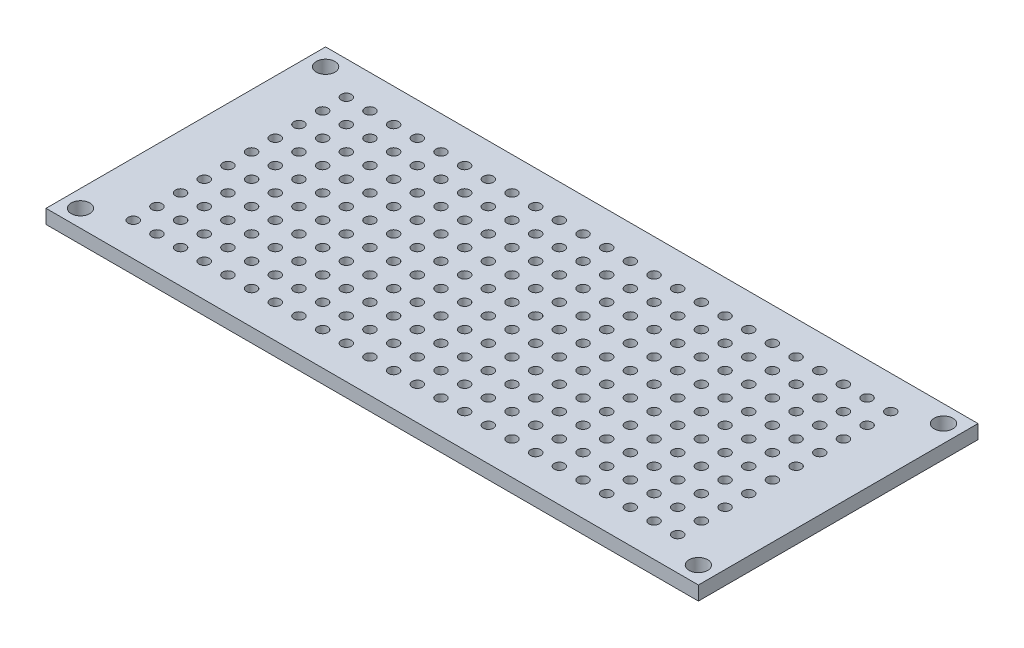
from build123d import *

# Parameters (mm, degrees)
SKETCH1_W           = 70
SKETCH1_H           = 30
BOSS_EXTRUDE1_DEPTH = 1.5
SKETCH2_R           = 0.55
CUT_EXTRUDE1_DEPTH  = 39.108398025
SKETCH3_R           = 1
CUT_EXTRUDE2_DEPTH  = 39.108398025


with BuildPart() as part:
    # Sketch1 → Boss-Extrude1 (new body)
    with BuildSketch(Plane(origin=(0, 0, 0), x_dir=(1, 0, 0), z_dir=(0, 1, 0))):
        Rectangle(SKETCH1_W, SKETCH1_H)
    extrude(amount=BOSS_EXTRUDE1_DEPTH)

    # Sketch2 → Cut-Extrude1 (cut, through all)
    with BuildSketch(Plane(origin=(0, 1.5, 0), x_dir=(1, 0, 0), z_dir=(0, 1, 0))):
        with Locations((1.27, 1.27)):
            Circle(SKETCH2_R)
        with Locations((3.81, 1.27)):
            Circle(SKETCH2_R)
        with Locations((6.35, 1.27)):
            Circle(SKETCH2_R)
        with Locations((8.89, 1.27)):
            Circle(SKETCH2_R)
        with Locations((11.43, 1.27)):
            Circle(SKETCH2_R)
        with Locations((13.97, 1.27)):
            Circle(SKETCH2_R)
        with Locations((16.51, 1.27)):
            Circle(SKETCH2_R)
        with Locations((19.05, 1.27)):
            Circle(SKETCH2_R)
        with Locations((21.59, 1.27)):
            Circle(SKETCH2_R)
        with Locations((24.13, 1.27)):
            Circle(SKETCH2_R)
        with Locations((26.67, 1.27)):
            Circle(SKETCH2_R)
        with Locations((29.21, 1.27)):
            Circle(SKETCH2_R)
        with Locations((3.81, 3.81)):
            Circle(SKETCH2_R)
        with Locations((6.35, 3.81)):
            Circle(SKETCH2_R)
        with Locations((8.89, 3.81)):
            Circle(SKETCH2_R)
        with Locations((11.43, 3.81)):
            Circle(SKETCH2_R)
        with Locations((13.97, 3.81)):
            Circle(SKETCH2_R)
        with Locations((16.51, 3.81)):
            Circle(SKETCH2_R)
        with Locations((19.05, 3.81)):
            Circle(SKETCH2_R)
        with Locations((21.59, 3.81)):
            Circle(SKETCH2_R)
        with Locations((24.13, 3.81)):
            Circle(SKETCH2_R)
        with Locations((26.67, 3.81)):
            Circle(SKETCH2_R)
        with Locations((29.21, 3.81)):
            Circle(SKETCH2_R)
        with Locations((3.81, 6.35)):
            Circle(SKETCH2_R)
        with Locations((6.35, 6.35)):
            Circle(SKETCH2_R)
        with Locations((8.89, 6.35)):
            Circle(SKETCH2_R)
        with Locations((11.43, 6.35)):
            Circle(SKETCH2_R)
        with Locations((13.97, 6.35)):
            Circle(SKETCH2_R)
        with Locations((16.51, 6.35)):
            Circle(SKETCH2_R)
        with Locations((19.05, 6.35)):
            Circle(SKETCH2_R)
        with Locations((21.59, 6.35)):
            Circle(SKETCH2_R)
        with Locations((24.13, 6.35)):
            Circle(SKETCH2_R)
        with Locations((26.67, 6.35)):
            Circle(SKETCH2_R)
        with Locations((29.21, 6.35)):
            Circle(SKETCH2_R)
        with Locations((3.81, 8.89)):
            Circle(SKETCH2_R)
        with Locations((6.35, 8.89)):
            Circle(SKETCH2_R)
        with Locations((8.89, 8.89)):
            Circle(SKETCH2_R)
        with Locations((11.43, 8.89)):
            Circle(SKETCH2_R)
        with Locations((13.97, 8.89)):
            Circle(SKETCH2_R)
        with Locations((16.51, 8.89)):
            Circle(SKETCH2_R)
        with Locations((19.05, 8.89)):
            Circle(SKETCH2_R)
        with Locations((21.59, 8.89)):
            Circle(SKETCH2_R)
        with Locations((24.13, 8.89)):
            Circle(SKETCH2_R)
        with Locations((26.67, 8.89)):
            Circle(SKETCH2_R)
        with Locations((29.21, 8.89)):
            Circle(SKETCH2_R)
        with Locations((3.81, 11.43)):
            Circle(SKETCH2_R)
        with Locations((6.35, 11.43)):
            Circle(SKETCH2_R)
        with Locations((8.89, 11.43)):
            Circle(SKETCH2_R)
        with Locations((11.43, 11.43)):
            Circle(SKETCH2_R)
        with Locations((13.97, 11.43)):
            Circle(SKETCH2_R)
        with Locations((16.51, 11.43)):
            Circle(SKETCH2_R)
        with Locations((19.05, 11.43)):
            Circle(SKETCH2_R)
        with Locations((21.59, 11.43)):
            Circle(SKETCH2_R)
        with Locations((24.13, 11.43)):
            Circle(SKETCH2_R)
        with Locations((26.67, 11.43)):
            Circle(SKETCH2_R)
        with Locations((29.21, 11.43)):
            Circle(SKETCH2_R)
        with Locations((1.27, 3.81)):
            Circle(SKETCH2_R)
        with Locations((1.27, 6.35)):
            Circle(SKETCH2_R)
        with Locations((1.27, 8.89)):
            Circle(SKETCH2_R)
        with Locations((1.27, 11.43)):
            Circle(SKETCH2_R)
        with Locations((1.27, -11.43)):
            Circle(SKETCH2_R)
        with Locations((1.27, -8.89)):
            Circle(SKETCH2_R)
        with Locations((1.27, -6.35)):
            Circle(SKETCH2_R)
        with Locations((1.27, -3.81)):
            Circle(SKETCH2_R)
        with Locations((29.21, -11.43)):
            Circle(SKETCH2_R)
        with Locations((26.67, -11.43)):
            Circle(SKETCH2_R)
        with Locations((24.13, -11.43)):
            Circle(SKETCH2_R)
        with Locations((21.59, -11.43)):
            Circle(SKETCH2_R)
        with Locations((19.05, -11.43)):
            Circle(SKETCH2_R)
        with Locations((16.51, -11.43)):
            Circle(SKETCH2_R)
        with Locations((13.97, -11.43)):
            Circle(SKETCH2_R)
        with Locations((11.43, -11.43)):
            Circle(SKETCH2_R)
        with Locations((8.89, -11.43)):
            Circle(SKETCH2_R)
        with Locations((6.35, -11.43)):
            Circle(SKETCH2_R)
        with Locations((3.81, -11.43)):
            Circle(SKETCH2_R)
        with Locations((29.21, -8.89)):
            Circle(SKETCH2_R)
        with Locations((26.67, -8.89)):
            Circle(SKETCH2_R)
        with Locations((24.13, -8.89)):
            Circle(SKETCH2_R)
        with Locations((21.59, -8.89)):
            Circle(SKETCH2_R)
        with Locations((19.05, -8.89)):
            Circle(SKETCH2_R)
        with Locations((16.51, -8.89)):
            Circle(SKETCH2_R)
        with Locations((13.97, -8.89)):
            Circle(SKETCH2_R)
        with Locations((11.43, -8.89)):
            Circle(SKETCH2_R)
        with Locations((8.89, -8.89)):
            Circle(SKETCH2_R)
        with Locations((6.35, -8.89)):
            Circle(SKETCH2_R)
        with Locations((3.81, -8.89)):
            Circle(SKETCH2_R)
        with Locations((29.21, -6.35)):
            Circle(SKETCH2_R)
        with Locations((26.67, -6.35)):
            Circle(SKETCH2_R)
        with Locations((24.13, -6.35)):
            Circle(SKETCH2_R)
        with Locations((21.59, -6.35)):
            Circle(SKETCH2_R)
        with Locations((19.05, -6.35)):
            Circle(SKETCH2_R)
        with Locations((16.51, -6.35)):
            Circle(SKETCH2_R)
        with Locations((13.97, -6.35)):
            Circle(SKETCH2_R)
        with Locations((11.43, -6.35)):
            Circle(SKETCH2_R)
        with Locations((8.89, -6.35)):
            Circle(SKETCH2_R)
        with Locations((6.35, -6.35)):
            Circle(SKETCH2_R)
        with Locations((3.81, -6.35)):
            Circle(SKETCH2_R)
        with Locations((29.21, -3.81)):
            Circle(SKETCH2_R)
        with Locations((26.67, -3.81)):
            Circle(SKETCH2_R)
        with Locations((24.13, -3.81)):
            Circle(SKETCH2_R)
        with Locations((21.59, -3.81)):
            Circle(SKETCH2_R)
        with Locations((19.05, -3.81)):
            Circle(SKETCH2_R)
        with Locations((16.51, -3.81)):
            Circle(SKETCH2_R)
        with Locations((13.97, -3.81)):
            Circle(SKETCH2_R)
        with Locations((11.43, -3.81)):
            Circle(SKETCH2_R)
        with Locations((8.89, -3.81)):
            Circle(SKETCH2_R)
        with Locations((6.35, -3.81)):
            Circle(SKETCH2_R)
        with Locations((3.81, -3.81)):
            Circle(SKETCH2_R)
        with Locations((29.21, -1.27)):
            Circle(SKETCH2_R)
        with Locations((26.67, -1.27)):
            Circle(SKETCH2_R)
        with Locations((24.13, -1.27)):
            Circle(SKETCH2_R)
        with Locations((21.59, -1.27)):
            Circle(SKETCH2_R)
        with Locations((19.05, -1.27)):
            Circle(SKETCH2_R)
        with Locations((16.51, -1.27)):
            Circle(SKETCH2_R)
        with Locations((13.97, -1.27)):
            Circle(SKETCH2_R)
        with Locations((11.43, -1.27)):
            Circle(SKETCH2_R)
        with Locations((8.89, -1.27)):
            Circle(SKETCH2_R)
        with Locations((6.35, -1.27)):
            Circle(SKETCH2_R)
        with Locations((3.81, -1.27)):
            Circle(SKETCH2_R)
        with Locations((1.27, -1.27)):
            Circle(SKETCH2_R)
        with Locations((-1.27, -1.27)):
            Circle(SKETCH2_R)
        with Locations((-3.81, -1.27)):
            Circle(SKETCH2_R)
        with Locations((-6.35, -1.27)):
            Circle(SKETCH2_R)
        with Locations((-8.89, -1.27)):
            Circle(SKETCH2_R)
        with Locations((-11.43, -1.27)):
            Circle(SKETCH2_R)
        with Locations((-13.97, -1.27)):
            Circle(SKETCH2_R)
        with Locations((-16.51, -1.27)):
            Circle(SKETCH2_R)
        with Locations((-19.05, -1.27)):
            Circle(SKETCH2_R)
        with Locations((-21.59, -1.27)):
            Circle(SKETCH2_R)
        with Locations((-24.13, -1.27)):
            Circle(SKETCH2_R)
        with Locations((-26.67, -1.27)):
            Circle(SKETCH2_R)
        with Locations((-29.21, -1.27)):
            Circle(SKETCH2_R)
        with Locations((-3.81, -3.81)):
            Circle(SKETCH2_R)
        with Locations((-6.35, -3.81)):
            Circle(SKETCH2_R)
        with Locations((-8.89, -3.81)):
            Circle(SKETCH2_R)
        with Locations((-11.43, -3.81)):
            Circle(SKETCH2_R)
        with Locations((-13.97, -3.81)):
            Circle(SKETCH2_R)
        with Locations((-16.51, -3.81)):
            Circle(SKETCH2_R)
        with Locations((-19.05, -3.81)):
            Circle(SKETCH2_R)
        with Locations((-21.59, -3.81)):
            Circle(SKETCH2_R)
        with Locations((-24.13, -3.81)):
            Circle(SKETCH2_R)
        with Locations((-26.67, -3.81)):
            Circle(SKETCH2_R)
        with Locations((-29.21, -3.81)):
            Circle(SKETCH2_R)
        with Locations((-3.81, -6.35)):
            Circle(SKETCH2_R)
        with Locations((-6.35, -6.35)):
            Circle(SKETCH2_R)
        with Locations((-8.89, -6.35)):
            Circle(SKETCH2_R)
        with Locations((-11.43, -6.35)):
            Circle(SKETCH2_R)
        with Locations((-13.97, -6.35)):
            Circle(SKETCH2_R)
        with Locations((-16.51, -6.35)):
            Circle(SKETCH2_R)
        with Locations((-19.05, -6.35)):
            Circle(SKETCH2_R)
        with Locations((-21.59, -6.35)):
            Circle(SKETCH2_R)
        with Locations((-24.13, -6.35)):
            Circle(SKETCH2_R)
        with Locations((-26.67, -6.35)):
            Circle(SKETCH2_R)
        with Locations((-29.21, -6.35)):
            Circle(SKETCH2_R)
        with Locations((-3.81, -8.89)):
            Circle(SKETCH2_R)
        with Locations((-6.35, -8.89)):
            Circle(SKETCH2_R)
        with Locations((-8.89, -8.89)):
            Circle(SKETCH2_R)
        with Locations((-11.43, -8.89)):
            Circle(SKETCH2_R)
        with Locations((-13.97, -8.89)):
            Circle(SKETCH2_R)
        with Locations((-16.51, -8.89)):
            Circle(SKETCH2_R)
        with Locations((-19.05, -8.89)):
            Circle(SKETCH2_R)
        with Locations((-21.59, -8.89)):
            Circle(SKETCH2_R)
        with Locations((-24.13, -8.89)):
            Circle(SKETCH2_R)
        with Locations((-26.67, -8.89)):
            Circle(SKETCH2_R)
        with Locations((-29.21, -8.89)):
            Circle(SKETCH2_R)
        with Locations((-3.81, -11.43)):
            Circle(SKETCH2_R)
        with Locations((-6.35, -11.43)):
            Circle(SKETCH2_R)
        with Locations((-8.89, -11.43)):
            Circle(SKETCH2_R)
        with Locations((-11.43, -11.43)):
            Circle(SKETCH2_R)
        with Locations((-13.97, -11.43)):
            Circle(SKETCH2_R)
        with Locations((-16.51, -11.43)):
            Circle(SKETCH2_R)
        with Locations((-19.05, -11.43)):
            Circle(SKETCH2_R)
        with Locations((-21.59, -11.43)):
            Circle(SKETCH2_R)
        with Locations((-24.13, -11.43)):
            Circle(SKETCH2_R)
        with Locations((-26.67, -11.43)):
            Circle(SKETCH2_R)
        with Locations((-29.21, -11.43)):
            Circle(SKETCH2_R)
        with Locations((-1.27, -3.81)):
            Circle(SKETCH2_R)
        with Locations((-1.27, -6.35)):
            Circle(SKETCH2_R)
        with Locations((-1.27, -8.89)):
            Circle(SKETCH2_R)
        with Locations((-1.27, -11.43)):
            Circle(SKETCH2_R)
        with Locations((-1.27, 11.43)):
            Circle(SKETCH2_R)
        with Locations((-1.27, 8.89)):
            Circle(SKETCH2_R)
        with Locations((-1.27, 6.35)):
            Circle(SKETCH2_R)
        with Locations((-1.27, 3.81)):
            Circle(SKETCH2_R)
        with Locations((-29.21, 11.43)):
            Circle(SKETCH2_R)
        with Locations((-26.67, 11.43)):
            Circle(SKETCH2_R)
        with Locations((-24.13, 11.43)):
            Circle(SKETCH2_R)
        with Locations((-21.59, 11.43)):
            Circle(SKETCH2_R)
        with Locations((-19.05, 11.43)):
            Circle(SKETCH2_R)
        with Locations((-16.51, 11.43)):
            Circle(SKETCH2_R)
        with Locations((-13.97, 11.43)):
            Circle(SKETCH2_R)
        with Locations((-11.43, 11.43)):
            Circle(SKETCH2_R)
        with Locations((-8.89, 11.43)):
            Circle(SKETCH2_R)
        with Locations((-6.35, 11.43)):
            Circle(SKETCH2_R)
        with Locations((-3.81, 11.43)):
            Circle(SKETCH2_R)
        with Locations((-29.21, 8.89)):
            Circle(SKETCH2_R)
        with Locations((-26.67, 8.89)):
            Circle(SKETCH2_R)
        with Locations((-24.13, 8.89)):
            Circle(SKETCH2_R)
        with Locations((-21.59, 8.89)):
            Circle(SKETCH2_R)
        with Locations((-19.05, 8.89)):
            Circle(SKETCH2_R)
        with Locations((-16.51, 8.89)):
            Circle(SKETCH2_R)
        with Locations((-13.97, 8.89)):
            Circle(SKETCH2_R)
        with Locations((-11.43, 8.89)):
            Circle(SKETCH2_R)
        with Locations((-8.89, 8.89)):
            Circle(SKETCH2_R)
        with Locations((-6.35, 8.89)):
            Circle(SKETCH2_R)
        with Locations((-3.81, 8.89)):
            Circle(SKETCH2_R)
        with Locations((-29.21, 6.35)):
            Circle(SKETCH2_R)
        with Locations((-26.67, 6.35)):
            Circle(SKETCH2_R)
        with Locations((-24.13, 6.35)):
            Circle(SKETCH2_R)
        with Locations((-21.59, 6.35)):
            Circle(SKETCH2_R)
        with Locations((-19.05, 6.35)):
            Circle(SKETCH2_R)
        with Locations((-16.51, 6.35)):
            Circle(SKETCH2_R)
        with Locations((-13.97, 6.35)):
            Circle(SKETCH2_R)
        with Locations((-11.43, 6.35)):
            Circle(SKETCH2_R)
        with Locations((-8.89, 6.35)):
            Circle(SKETCH2_R)
        with Locations((-6.35, 6.35)):
            Circle(SKETCH2_R)
        with Locations((-3.81, 6.35)):
            Circle(SKETCH2_R)
        with Locations((-29.21, 3.81)):
            Circle(SKETCH2_R)
        with Locations((-26.67, 3.81)):
            Circle(SKETCH2_R)
        with Locations((-24.13, 3.81)):
            Circle(SKETCH2_R)
        with Locations((-21.59, 3.81)):
            Circle(SKETCH2_R)
        with Locations((-19.05, 3.81)):
            Circle(SKETCH2_R)
        with Locations((-16.51, 3.81)):
            Circle(SKETCH2_R)
        with Locations((-13.97, 3.81)):
            Circle(SKETCH2_R)
        with Locations((-11.43, 3.81)):
            Circle(SKETCH2_R)
        with Locations((-8.89, 3.81)):
            Circle(SKETCH2_R)
        with Locations((-6.35, 3.81)):
            Circle(SKETCH2_R)
        with Locations((-3.81, 3.81)):
            Circle(SKETCH2_R)
        with Locations((-29.21, 1.27)):
            Circle(SKETCH2_R)
        with Locations((-26.67, 1.27)):
            Circle(SKETCH2_R)
        with Locations((-24.13, 1.27)):
            Circle(SKETCH2_R)
        with Locations((-21.59, 1.27)):
            Circle(SKETCH2_R)
        with Locations((-19.05, 1.27)):
            Circle(SKETCH2_R)
        with Locations((-16.51, 1.27)):
            Circle(SKETCH2_R)
        with Locations((-13.97, 1.27)):
            Circle(SKETCH2_R)
        with Locations((-11.43, 1.27)):
            Circle(SKETCH2_R)
        with Locations((-8.89, 1.27)):
            Circle(SKETCH2_R)
        with Locations((-6.35, 1.27)):
            Circle(SKETCH2_R)
        with Locations((-3.81, 1.27)):
            Circle(SKETCH2_R)
        with Locations((-1.27, 1.27)):
            Circle(SKETCH2_R)
    extrude(amount=-CUT_EXTRUDE1_DEPTH, mode=Mode.SUBTRACT)

    # Sketch3 → Cut-Extrude2 (cut, through all)
    with BuildSketch(Plane(origin=(0, 1.5, 0), x_dir=(1, 0, 0), z_dir=(0, 1, 0))):
        with Locations((-33.15, 13.15)):
            Circle(SKETCH3_R)
        with Locations((33.15, 13.15)):
            Circle(SKETCH3_R)
        with Locations((-33.15, -13.15)):
            Circle(SKETCH3_R)
        with Locations((33.15, -13.15)):
            Circle(SKETCH3_R)
    extrude(amount=-CUT_EXTRUDE2_DEPTH, mode=Mode.SUBTRACT)


solid = part.part
